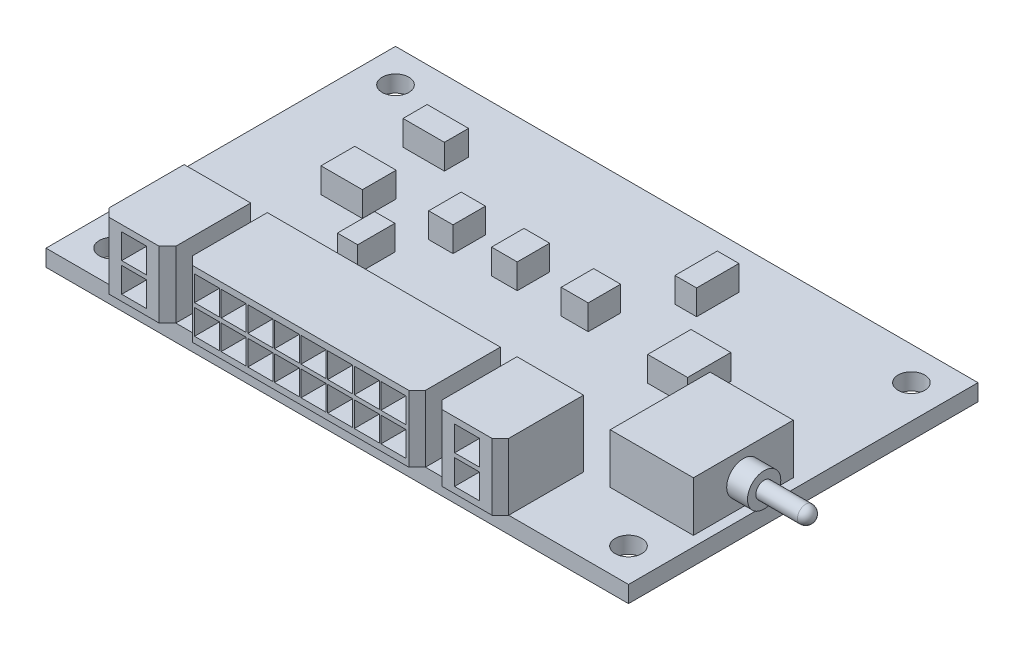
from build123d import *

# Parameters (mm, degrees)
SKETCH1_W           = 70
SKETCH1_H           = 42
BOSS_EXTRUDE1_DEPTH = 2
SKETCH4_R           = 1.6
CUT_EXTRUDE2_DEPTH  = 82.65782265
BOSS_EXTRUDE2_DEPTH = 8
SKETCH6_W           = 3
SKETCH6_H           = 3
CUT_EXTRUDE3_DEPTH  = 9
SKETCH7_W           = 10
SKETCH7_H           = 12
BOSS_EXTRUDE3_DEPTH = 6
SKETCH8_R           = 2
BOSS_EXTRUDE4_DEPTH = 2.5
SKETCH9_R           = 1
BOSS_EXTRUDE5_DEPTH = 5
SKETCH10_W          = 4.972668361
SKETCH10_H          = 2.900723211
SKETCH10_H_2        = 4.06167287
SKETCH10_W_2        = 4.792773987
SKETCH10_H_3        = 5.198941274
SKETCH10_W_3        = 2.924404467
SKETCH10_H_4        = 3.899205956
SKETCH10_W_4        = 3.086871382
SKETCH10_W_5        = 3.249338296
SKETCH10_W_6        = 2.437003722
SKETCH10_H_5        = 4.467840158
SKETCH10_W_7        = 2.599470637
SKETCH10_H_6        = 5.088357614
BOSS_EXTRUDE6_DEPTH = 3


# Read off the part's stored shape, not the designer's step: Dome1
with BuildPart() as part:
    # Sketch1 → Boss-Extrude1 (new body)
    with BuildSketch(Plane(origin=(0, 0, 0), x_dir=(1, 0, 0), z_dir=(0, 1, 0))):
        with Locations((35, 21)):
            Rectangle(SKETCH1_W, SKETCH1_H)
    extrude(amount=BOSS_EXTRUDE1_DEPTH)

    # Sketch4 → Cut-Extrude2 (cut, through all)
    with BuildSketch(Plane(origin=(0, 2, 0), x_dir=(1, 0, 0), z_dir=(0, 1, 0))):
        with Locations(Location((4, 38, 0), (0, 0, 270))):
            Circle(SKETCH4_R)
        with Locations(Location((66, 4, 0), (0, 0, 270))):
            Circle(SKETCH4_R)
        with Locations(Location((4, 4, 0), (0, 0, 90))):
            Circle(SKETCH4_R)
        with Locations(Location((66, 38, 0), (0, 0, 90))):
            Circle(SKETCH4_R)
    extrude(amount=-CUT_EXTRUDE2_DEPTH, mode=Mode.SUBTRACT)

    # Sketch5 → Boss-Extrude2 (add)
    with BuildSketch(Plane(origin=(0, 2, 0), x_dir=(1, 0, 0), z_dir=(0, 1, 0))):
        Polygon((17.6, 9), (45.6, 9), (45.6, 0), (44.6, -1), (18.6, -1), (17.6, 0), align=None)
        Polygon((7.6, 9), (15.6, 9), (15.6, 0), (14.6, -1), (8.6, -1), (7.6, 0), align=None)
        Polygon((47.6, 9), (55.6, 9), (55.6, 0), (54.6, -1), (48.6, -1), (47.6, 0), align=None)
    extrude(amount=BOSS_EXTRUDE2_DEPTH)

    # Sketch6 → Cut-Extrude3 (cut)
    with BuildSketch(Plane.XY.offset(1)):
        with Locations((20.35, 4.25)):
            Rectangle(SKETCH6_W, SKETCH6_H)
        with Locations((11.6, 7.75)):
            Rectangle(SKETCH6_W, SKETCH6_H)
        with Locations((23.55, 4.25)):
            Rectangle(SKETCH6_W, SKETCH6_H)
        with Locations((11.6, 4.25)):
            Rectangle(SKETCH6_W, SKETCH6_H)
        with Locations((20.35, 7.75)):
            Rectangle(SKETCH6_W, SKETCH6_H)
        with Locations((51.6, 7.75)):
            Rectangle(SKETCH6_W, SKETCH6_H)
        with Locations((23.55, 7.75)):
            Rectangle(SKETCH6_W, SKETCH6_H)
        with Locations((26.75, 4.25)):
            Rectangle(SKETCH6_W, SKETCH6_H)
        with Locations((26.75, 7.75)):
            Rectangle(SKETCH6_W, SKETCH6_H)
        with Locations((29.95, 4.25)):
            Rectangle(SKETCH6_W, SKETCH6_H)
        with Locations((29.95, 7.75)):
            Rectangle(SKETCH6_W, SKETCH6_H)
        with Locations((33.15, 4.25)):
            Rectangle(SKETCH6_W, SKETCH6_H)
        with Locations((33.15, 7.75)):
            Rectangle(SKETCH6_W, SKETCH6_H)
        with Locations((36.35, 4.25)):
            Rectangle(SKETCH6_W, SKETCH6_H)
        with Locations((36.35, 7.75)):
            Rectangle(SKETCH6_W, SKETCH6_H)
        with Locations((39.55, 4.25)):
            Rectangle(SKETCH6_W, SKETCH6_H)
        with Locations((39.55, 7.75)):
            Rectangle(SKETCH6_W, SKETCH6_H)
        with Locations((42.75, 4.25)):
            Rectangle(SKETCH6_W, SKETCH6_H)
        with Locations((42.75, 7.75)):
            Rectangle(SKETCH6_W, SKETCH6_H)
        with Locations((51.6, 4.25)):
            Rectangle(SKETCH6_W, SKETCH6_H)
    extrude(amount=-CUT_EXTRUDE3_DEPTH, mode=Mode.SUBTRACT)

    # Sketch7 → Boss-Extrude3 (add)
    with BuildSketch(Plane(origin=(0, 2, 0), x_dir=(1, 0, 0), z_dir=(0, 1, 0))):
        with Locations((63.8, 15)):
            Rectangle(SKETCH7_W, SKETCH7_H)
    extrude(amount=BOSS_EXTRUDE3_DEPTH)

    # Sketch8 → Boss-Extrude4 (add)
    with BuildSketch(Plane(origin=(68.8, 0, 0), x_dir=(0, 0, -1), z_dir=(1, 0, 0))):
        with Locations(Location((15, 5, 0), (0, 0, 180))):
            Circle(SKETCH8_R)
    extrude(amount=BOSS_EXTRUDE4_DEPTH)

    # Sketch9 → Boss-Extrude5 (add)
    with BuildSketch(Plane(origin=(71.3, 0, 0), x_dir=(0, 0, -1), z_dir=(1, 0, 0))):
        with Locations((15, 5)):
            Circle(SKETCH9_R)
    extrude(amount=BOSS_EXTRUDE5_DEPTH)

    # Dome1 outline → Dome1 (revolve)
    with BuildSketch(Plane(origin=(0, 5, -15), x_dir=(0, 1, 0), z_dir=(0, 0, -1))):
        with BuildLine():
            Line((0, 76.3), (1, 76.299999999))
            ThreePointArc((1, 76.299999999), (0.707106782, 77.007106781), (0, 77.3))
            Line((0, 77.3), (0, 76.3))
        make_face()
    revolve(axis=Axis((0, 5, -15), (1, 0, 0)))

    # Sketch10 → Boss-Extrude6 (add)
    with BuildSketch(Plane(origin=(0, 2, 0), x_dir=(1, 0, 0), z_dir=(0, 1, 0))):
        with Locations((13.43956041, 33.400988797)):
            Rectangle(SKETCH10_W, SKETCH10_H)
        with Locations((13.43956041, 24.122865076)):
            Rectangle(SKETCH10_W, SKETCH10_H_2)
        with Locations((52.609554771, 24.691499278)):
            Rectangle(SKETCH10_W_2, SKETCH10_H_3)
        with Locations((23.568593744, 25.828767682)):
            Rectangle(SKETCH10_W_3, SKETCH10_H_4)
        with Locations((31.204538742, 25.828767682)):
            Rectangle(SKETCH10_W_4, SKETCH10_H_4)
        with Locations((39.652818313, 25.828767682)):
            Rectangle(SKETCH10_W_5, SKETCH10_H_4)
        with Locations((20.156788533, 18.314672871)):
            Rectangle(SKETCH10_W_6, SKETCH10_H_5)
        with Locations((44.932993045, 34.494805998)):
            Rectangle(SKETCH10_W_7, SKETCH10_H_6)
    extrude(amount=BOSS_EXTRUDE6_DEPTH)


solid = part.part
